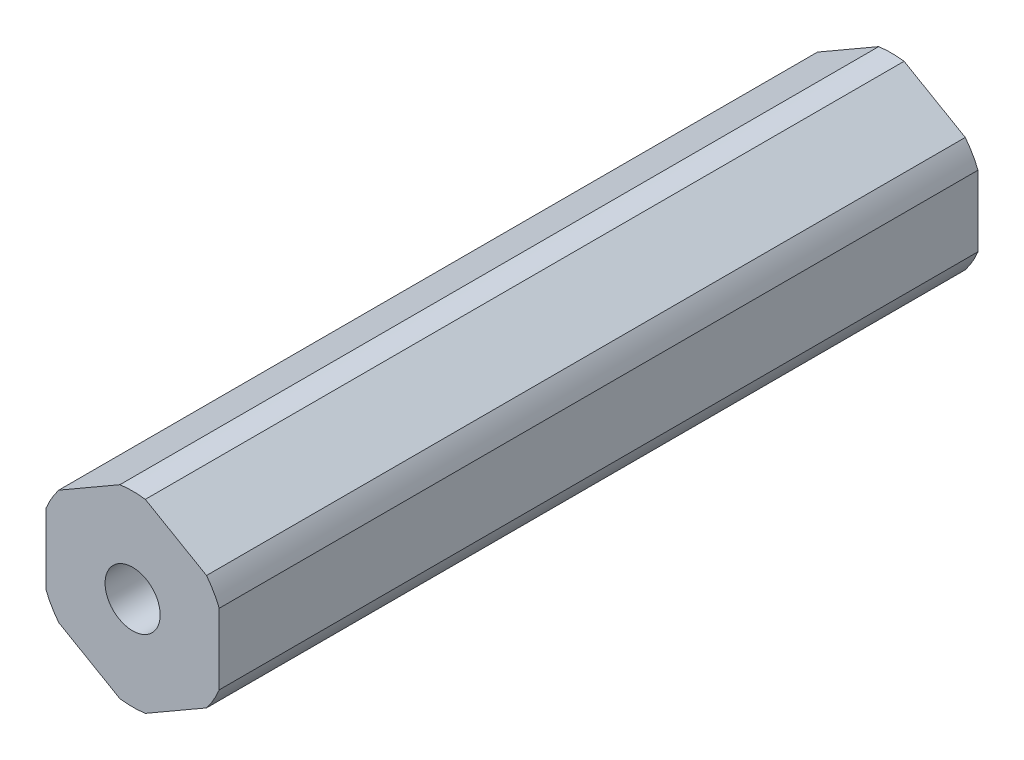
from build123d import *

# Parameters (mm, degrees)
BOSS_EXTRUDE1_DEPTH = 55.626
SKETCH2_R           = 2.0193
CUT_EXTRUDE1_DEPTH  = 57.405731446


with BuildPart() as part:
    # Sketch1 → Boss-Extrude1 (new body)
    with BuildSketch(Plane.XY):
        with BuildLine():
            Line((-0.93173274, 6.79441227), (-5.41826726, 4.204110358))
            ThreePointArc((-5.41826726, 4.204110358), (-5.939202219, 3.429), (-6.35, 2.590301913))
            Line((-6.35, 2.590301913), (-6.35, -2.590301913))
            ThreePointArc((-6.35, -2.590301913), (-5.939202219, -3.429), (-5.41826726, -4.204110358))
            Line((-5.41826726, -4.204110358), (-0.93173274, -6.79441227))
            ThreePointArc((-0.93173274, -6.79441227), (0, -6.858), (0.93173274, -6.79441227))
            Line((0.93173274, -6.79441227), (5.41826726, -4.204110358))
            ThreePointArc((5.41826726, -4.204110358), (5.939202219, -3.429), (6.35, -2.590301913))
            Line((6.35, -2.590301913), (6.35, 2.590301913))
            ThreePointArc((6.35, 2.590301913), (5.939202219, 3.429), (5.41826726, 4.204110358))
            Line((5.41826726, 4.204110358), (0.93173274, 6.79441227))
            ThreePointArc((0.93173274, 6.79441227), (0, 6.858), (-0.93173274, 6.79441227))
        make_face()
    extrude(amount=BOSS_EXTRUDE1_DEPTH)

    # Sketch2 → Cut-Extrude1 (cut, through all)
    with BuildSketch(Plane.XY.offset(55.626)):
        Circle(SKETCH2_R)
    extrude(amount=-CUT_EXTRUDE1_DEPTH, mode=Mode.SUBTRACT)


solid = part.part
